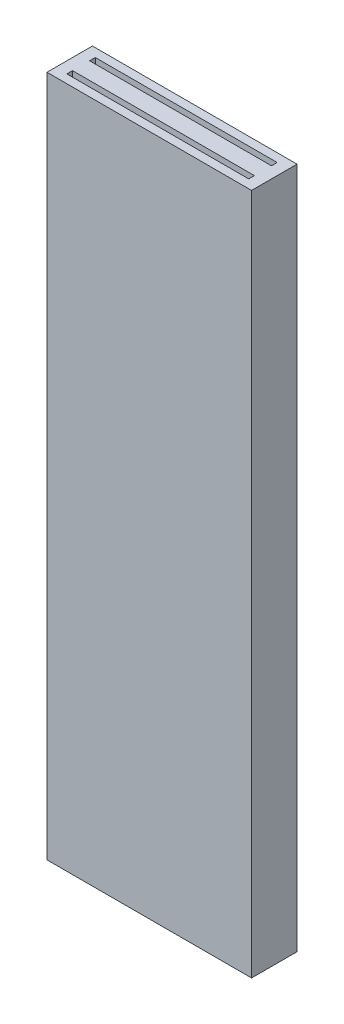
from build123d import *

# Parameters (mm, degrees)
SKETCH1_W           = 9
SKETCH1_H           = 2
BOSS_EXTRUDE1_DEPTH = 15
SKETCH2_W           = 8
SKETCH2_H           = 0.25
CUT_EXTRUDE1_DEPTH  = 31.352100422


with BuildPart() as part:
    # Sketch1 → Boss-Extrude1 (new, symmetric)
    with BuildSketch(Plane(origin=(0, 0, 0), x_dir=(1, 0, 0), z_dir=(0, 1, 0))):
        Rectangle(SKETCH1_W, SKETCH1_H)
    extrude(amount=BOSS_EXTRUDE1_DEPTH, both=True)

    # Sketch2 → Cut-Extrude1 (cut, symmetric)
    with BuildSketch(Plane(origin=(0, 15, 0), x_dir=(1, 0, 0), z_dir=(0, 1, 0))):
        with Locations((0, 0.5)):
            Rectangle(SKETCH2_W, SKETCH2_H)
    cut_extrude1 = extrude(amount=CUT_EXTRUDE1_DEPTH, both=True, mode=Mode.SUBTRACT)

    # Mirror1: Cut-Extrude1 across plane
    add(cut_extrude1.mirror(Plane.XY), mode=Mode.SUBTRACT)


solid = part.part
